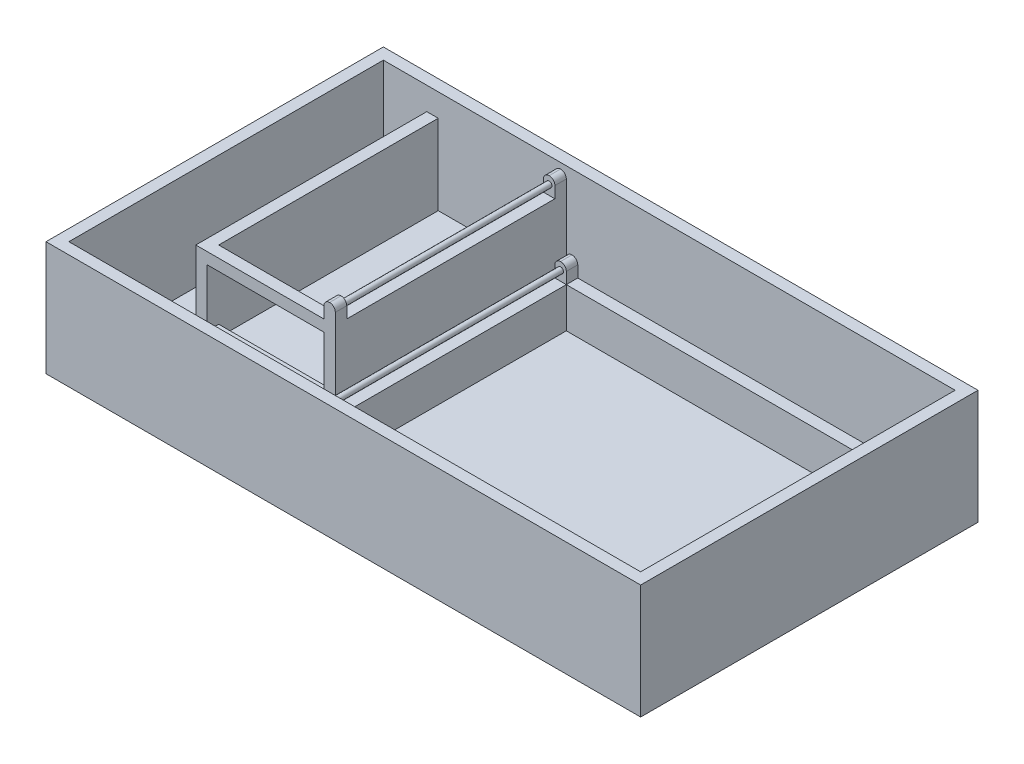
from build123d import *

# Parameters (mm, degrees)
SKETCH1_W              = 127
SKETCH1_H              = 69.85
BASE_DEPTH             = 2.54
SKETCH2_W              = 73.66
SKETCH2_H              = 58.42
SKETCH2_W_2            = 68.58
SKETCH2_H_2            = 53.34
PCB_HOLDER_DEPTH       = 8.89
SKETCH1_3_W            = 132.08
SKETCH1_3_H            = 74.93
SKETCH1_3_W_2          = 127
SKETCH1_3_H_2          = 69.85
BOSS_EXTRUDE5_DEPTH    = 25.4
BOSS_EXTRUDE6_DEPTH    = 17.78
SKETCH7_W              = 25.908
SKETCH7_H              = 12.7
BATTERY_GAP_DEPTH      = 2.54
SKETCH4_R              = 1.5875
WIRE_GAP_DEPTH         = 2.54
SKETCH8_W              = 2.54
SKETCH8_H              = 2.54
PCB_HOLDER_HINGE_DEPTH = 3.81
FILLET4_R              = 1.27
SKETCH13_R             = 0.635
BOSS_EXTRUDE10_DEPTH   = 53.34
SKETCH14_W             = 2.54
SKETCH14_H             = 2.54
BOSS_EXTRUDE11_DEPTH   = 3.81
FILLET5_R              = 1.27
SKETCH15_R             = 0.635
BOSS_EXTRUDE13_DEPTH   = 46.228


with BuildPart() as part:
    # Sketch1 → Base (new body)
    with BuildSketch(Plane(origin=(0, 0, 0), x_dir=(1, 0, 0), z_dir=(0, 1, 0))):
        Rectangle(SKETCH1_W, SKETCH1_H)
    extrude(amount=BASE_DEPTH)

    # Sketch2 → PCB-Holder (add)
    with BuildSketch(Plane(origin=(0, 2.54, 0), x_dir=(1, 0, 0), z_dir=(0, 1, 0))):
        with Locations((20.32, -0.635)):
            Rectangle(SKETCH2_W, SKETCH2_H)
        with Locations((20.32, -0.635)):
            Rectangle(SKETCH2_W_2, SKETCH2_H_2, mode=Mode.SUBTRACT)
    extrude(amount=PCB_HOLDER_DEPTH)

    # Sketch1<3> → Boss-Extrude5 (add)
    with BuildSketch(Plane(origin=(0, 0, 0), x_dir=(1, 0, 0), z_dir=(0, 1, 0))):
        Rectangle(SKETCH1_3_W, SKETCH1_3_H)
        Rectangle(SKETCH1_3_W_2, SKETCH1_3_H_2, mode=Mode.SUBTRACT)
    extrude(amount=BOSS_EXTRUDE5_DEPTH)

    # Sketch6 → Boss-Extrude6 (add)
    with BuildSketch(Plane(origin=(0, 2.54, 0), x_dir=(1, 0, 0), z_dir=(0, 1, 0))):
        Polygon((-51.308, -13.843), (-51.308, 34.925), (-53.848, 34.925), (-53.848, -16.383), (-22.86, -16.383), (-22.86, 34.925), (-25.4, 34.925), (-25.4, -13.843), align=None)
    extrude(amount=BOSS_EXTRUDE6_DEPTH)

    # Sketch7 → Battery-Gap (cut)
    with BuildSketch(Plane.XY.offset(16.383)):
        with Locations((-38.354, 11.43)):
            Rectangle(SKETCH7_W, SKETCH7_H)
    extrude(amount=-BATTERY_GAP_DEPTH, mode=Mode.SUBTRACT)

    # Sketch4 → Wire-Gap (cut)
    with BuildSketch(Plane.ZY.offset(16.51)):
        with Locations((22.225, 6.985)):
            Circle(SKETCH4_R)
    extrude(amount=-WIRE_GAP_DEPTH, mode=Mode.SUBTRACT)

    # Sketch8 → PCB-Holder-Hinge (add)
    with BuildSketch(Plane(origin=(0, 11.43, 0), x_dir=(1, 0, 0), z_dir=(0, 1, 0))):
        with Locations((-15.24, -28.575)):
            Rectangle(SKETCH8_W, SKETCH8_H)
        with Locations((-15.24, 27.305)):
            Rectangle(SKETCH8_W, SKETCH8_H)
    extrude(amount=PCB_HOLDER_HINGE_DEPTH)

    # Fillet4
    fillet4_edges = [part.edges().sort_by_distance(p)[0] for p in [
        (-16.51, 15.24, -27.305),
        (-13.97, 15.24, -27.305),
        (-13.97, 15.24, 28.575),
        (-16.51, 15.24, 28.575),
    ]]
    fillet(fillet4_edges, radius=FILLET4_R - 0.0001)  # a hair under: the kernel refuses the full size

    # Sketch13 → Boss-Extrude10 (add)
    with BuildSketch(Plane.XY.offset(-26.035)):
        with Locations(Location((-15.24, 13.589, 0), (0, 0, 180))):
            Circle(SKETCH13_R)
    extrude(amount=BOSS_EXTRUDE10_DEPTH)

    # Sketch14 → Boss-Extrude11 (add)
    with BuildSketch(Plane(origin=(0, 20.32, 0), x_dir=(1, 0, 0), z_dir=(0, 1, 0))):
        with Locations((-24.13, -15.113)):
            Rectangle(SKETCH14_W, SKETCH14_H)
        with Locations((-24.13, 33.655)):
            Rectangle(SKETCH14_W, SKETCH14_H)
    extrude(amount=BOSS_EXTRUDE11_DEPTH)

    # Fillet5
    fillet5_edges = [part.edges().sort_by_distance(p)[0] for p in [
        (-22.86, 24.13, -33.655),
        (-25.4, 24.13, -33.655),
        (-25.4, 24.13, 15.113),
        (-22.86, 24.13, 15.113),
    ]]
    fillet(fillet5_edges, radius=FILLET5_R - 0.0001)  # a hair under: the kernel refuses the full size

    # Sketch15 → Boss-Extrude13 (add)
    with BuildSketch(Plane.XY.offset(-32.385)):
        with Locations(Location((-24.13, 22.479, 0), (0, 0, 180))):
            Circle(SKETCH15_R)
    extrude(amount=BOSS_EXTRUDE13_DEPTH)


solid = part.part
